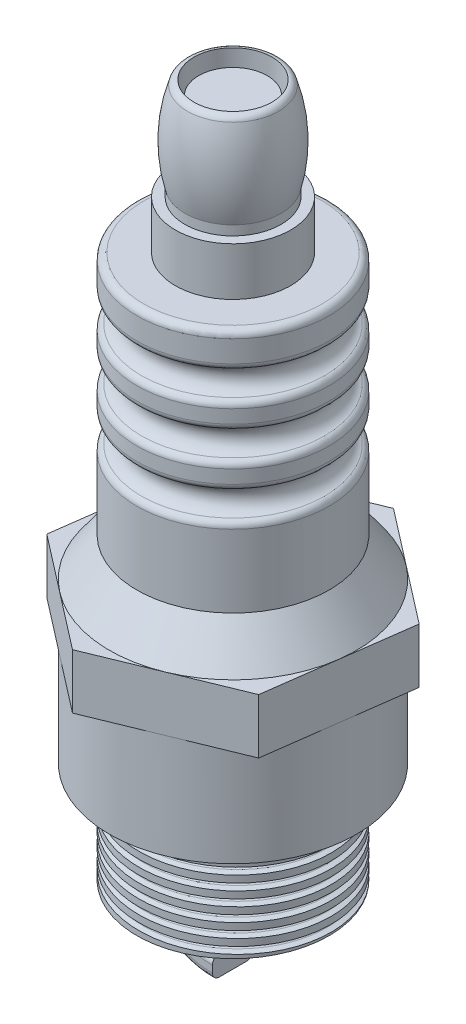
from build123d import *

# Parameters (mm, degrees)
BOSS_EXTRUDE1_DEPTH = 4
CUT_SWEEP1_PITCH    = 1
CUT_SWEEP1_FROM     = 0
SKETCH7_R           = 3.75
SKETCH7_R_2         = 2.5
CUT_EXTRUDE1_DEPTH  = 7.4
SKETCH8_R           = 1.25
BOSS_EXTRUDE2_DEPTH = 1
SKETCH11_R          = 2.842717716
CUT_EXTRUDE2_DEPTH  = 2
SKETCH12_R          = 2.5
BOSS_EXTRUDE3_DEPTH = 1


with BuildPart() as part:
    # Sketch1 → Revolve1 (revolve)
    with BuildSketch(Plane.XY, mode=Mode.PRIVATE) as revolve1_sk:
        Polygon((0, 0), (7, 0), (7, 7.4), (9, 7.4), (9, 19), (7, 21.8), (0, 21.8), align=None)
        with BuildLine():
            Line((0, 39.6), (0, 21.8))
            Line((0, 21.8), (7, 21.8))
            Line((7, 21.8), (7, 27.085786438))
            ThreePointArc((7, 27.085786438), (6.90824829, 27.374461572), (6.666666667, 27.557190958))
            ThreePointArc((6.666666667, 27.557190958), (6, 28.5), (6.666666667, 29.442809042))
            ThreePointArc((6.666666667, 29.442809042), (6.90824829, 29.625538428), (7, 29.914213562))
            Line((7, 29.914213562), (7, 30.885786438))
            ThreePointArc((7, 30.885786438), (6.90824829, 31.174461572), (6.666666667, 31.357190958))
            ThreePointArc((6.666666667, 31.357190958), (6, 32.3), (6.666666667, 33.242809042))
            ThreePointArc((6.666666667, 33.242809042), (6.90824829, 33.425538428), (7, 33.714213562))
            Line((7, 33.714213562), (7, 34.685786438))
            ThreePointArc((7, 34.685786438), (6.90824829, 34.974461572), (6.666666667, 35.157190958))
            ThreePointArc((6.666666667, 35.157190958), (6, 36.1), (6.666666667, 37.042809042))
            ThreePointArc((6.666666667, 37.042809042), (6.90824829, 37.225538428), (7, 37.514213562))
            Line((7, 37.514213562), (7, 39.1))
            ThreePointArc((7, 39.1), (6.853553391, 39.453553391), (6.5, 39.6))
            Line((6.5, 39.6), (4.2, 39.6))
            Line((4.2, 39.6), (0, 39.6))
        make_face()
        with BuildLine():
            Line((0, 50.5), (0, 39.6))
            Line((0, 39.6), (4.2, 39.6))
            Line((4.2, 39.6), (4.2, 43.11249535))
            Line((4.2, 43.11249535), (3.5, 43.11249535))
            Line((3.5, 43.11249535), (3.5, 43.806615202))
            ThreePointArc((3.5, 43.806615202), (3.864448874, 46.993450399), (3.318337588, 50.154226256))
            ThreePointArc((3.318337588, 50.154226256), (3.136730363, 50.40442127), (2.842717716, 50.5))
            Line((2.842717716, 50.5), (0, 50.5))
        make_face()
    revolve(revolve1_sk.sketch.rotate(Axis((0, 0, 0), (0, 1, 0)), 90), axis=Axis((0, 0, 0), (0, 1, 0)))

    # Sketch2 → Boss-Extrude1 (add)
    with BuildSketch(Plane(origin=(0, 19, 0), x_dir=(1, 0, 0), z_dir=(0, 1, 0))):
        Polygon((-8.224076362, 6.353311577), (-9.614167405, -3.945603264), (-1.390091042, -10.298914841), (8.224076362, -6.353311577), (9.614167405, 3.945603264), (1.390091042, 10.298914841), align=None)
    extrude(amount=-BOSS_EXTRUDE1_DEPTH)

    # Cut-Sweep1: arcs per turn and ends read off the stored shape
    # Cut-Sweep1: the profile of Sketch6 screwed along a left-hand helix through 9.25 turns, 8 arcs to a turn; built about Z, then put on its axis
    cut_sweep1_z = Axis((0, 0, 0), (0, 0, 1))
    cut_sweep1_corners = [(6.655113971, 0, -1.141834799), (7.005113971, 0, -1.248330775), (7.005113971, 0, -0.748330775), (6.655113971, 0, -0.854826751), (6.548778546, 0, -0.998330775)]
    with BuildLine(mode=Mode.PRIVATE) as cut_sweep1_profile:
        Line(cut_sweep1_corners[0], cut_sweep1_corners[1])
        Line(cut_sweep1_corners[1], cut_sweep1_corners[2])
        Line(cut_sweep1_corners[2], cut_sweep1_corners[3])
        ThreePointArc((6.655113971, 0, -0.854826751), (6.578259489, 0, -0.909027041), (6.548778546, 0, -0.998330775))
        ThreePointArc((6.548778546, 0, -0.998330775), (6.578259489, 0, -1.087634509), (6.655113971, 0, -1.141834799))
    cut_sweep1_cap = Face(cut_sweep1_profile.wire())
    cut_sweep1_arcs = [((6.655113971, 0, -0.854826751), (6.548778546, 0, -0.887181879), (6.548778546, 0, -0.998330775), (1, 0.8034603797536841, 1)), ((6.548778546, 0, -0.998330775), (6.548778546, 0, -1.109479671), (6.655113971, 0, -1.141834799), (1, 0.8034603797536841, 1))]  # start, shoulder, end, weights
    cut_sweep1_turn_angles = [0, -22.5, -45, -67.5, -90, -112.5, -135, -157.5, -180, -202.5, -225, -247.5, -270, -292.5, -315, -337.5, -360]
    cut_sweep1_turn_weights = [1, 0.9238795325112867, 1, 0.9238795325112867, 1, 0.9238795325112867, 1, 0.9238795325112867, 1, 0.9238795325112867, 1, 0.9238795325112867, 1, 0.9238795325112867, 1, 0.9238795325112867, 1]
    cut_sweep1_turn_rails = [Edge.make_bspline([Vector(p[0], p[1], 0).rotate(cut_sweep1_z, cut_sweep1_turn_angles[k]) / cut_sweep1_turn_weights[k] + Vector(0, 0, p[2] + -CUT_SWEEP1_PITCH * cut_sweep1_turn_angles[k] / 360) for k in range(17)], [0, 0, 0, 1, 1, 2, 2, 3, 3, 4, 4, 5, 5, 6, 6, 7, 7, 8, 8, 8], 2, cut_sweep1_turn_weights) for p in cut_sweep1_corners]
    cut_sweep1_turn_sides = [*[Face.make_surface_from_curves(cut_sweep1_turn_rails[p[0]], cut_sweep1_turn_rails[p[1]]) for p in [(0, 1), (1, 2), (2, 3)]], *[Face.make_bezier_surface([[Vector(p[j][0], p[j][1], 0).rotate(cut_sweep1_z, cut_sweep1_turn_angles[2 * i + k]) / cut_sweep1_turn_weights[2 * i + k] + Vector(0, 0, p[j][2] + -CUT_SWEEP1_PITCH * cut_sweep1_turn_angles[2 * i + k] / 360) for k in range(3)] for j in range(3)], [[p[3][j] * cut_sweep1_turn_weights[2 * i + k] for k in range(3)] for j in range(3)]) for p in cut_sweep1_arcs for i in range(8)]]
    cut_sweep1_last_angles = [-3240, -3262.5, -3285, -3307.5, -3330]
    cut_sweep1_last_weights = [1, 0.9238795325112867, 1, 0.9238795325112867, 1]
    cut_sweep1_last_rails = [Edge.make_bspline([Vector(p[0], p[1], 0).rotate(cut_sweep1_z, cut_sweep1_last_angles[k]) / cut_sweep1_last_weights[k] + Vector(0, 0, p[2] + -CUT_SWEEP1_PITCH * cut_sweep1_last_angles[k] / 360) for k in range(5)], [0, 0, 0, 1, 1, 2, 2, 2], 2, cut_sweep1_last_weights) for p in cut_sweep1_corners]
    cut_sweep1_last_sides = [*[Face.make_surface_from_curves(cut_sweep1_last_rails[p[0]], cut_sweep1_last_rails[p[1]]) for p in [(0, 1), (1, 2), (2, 3)]], *[Face.make_bezier_surface([[Vector(p[j][0], p[j][1], 0).rotate(cut_sweep1_z, cut_sweep1_last_angles[2 * i + k]) / cut_sweep1_last_weights[2 * i + k] + Vector(0, 0, p[j][2] + -CUT_SWEEP1_PITCH * cut_sweep1_last_angles[2 * i + k] / 360) for k in range(3)] for j in range(3)], [[p[3][j] * cut_sweep1_last_weights[2 * i + k] for k in range(3)] for j in range(3)]) for p in cut_sweep1_arcs for i in range(2)]]
    cut_sweep1 = Plane(origin=(0, 7.4, 0), x_dir=(1, 0, 0), z_dir=(0, -1, 0)) * split(Solid(Shell([*[p.moved(Location((0, 0, CUT_SWEEP1_PITCH * i))) for i in range(9) for p in cut_sweep1_turn_sides], *cut_sweep1_last_sides, cut_sweep1_cap, cut_sweep1_cap.rotate(cut_sweep1_z, -3330).moved(Location((0, 0, -CUT_SWEEP1_PITCH * -3330 / 360)))])), bisect_by=Plane.XY.offset(CUT_SWEEP1_FROM), keep=Keep.TOP, mode=Mode.PRIVATE)
    add(cut_sweep1, mode=Mode.SUBTRACT)

    # Sketch7 → Cut-Extrude1 (cut)
    with BuildSketch(Plane.XZ):
        with Locations(Location((0, 0, 0), (0, 0, 270))):
            Circle(SKETCH7_R)
        with Locations(Location((0, 0, 0), (0, 0, 270))):
            Circle(SKETCH7_R_2, mode=Mode.SUBTRACT)
    extrude(amount=-CUT_EXTRUDE1_DEPTH, mode=Mode.SUBTRACT)

    # Sketch8 → Boss-Extrude2 (add)
    with BuildSketch(Plane.XZ):
        with Locations(Location((0, 0, 0), (0, 0, 270))):
            Circle(SKETCH8_R)
    extrude(amount=BOSS_EXTRUDE2_DEPTH)

    # Sweep1: sweep along a path in Sketch10
    with BuildLine(Plane.XY) as sweep1_path:
        ThreePointArc((-5, 0), (-3.505500474, -3.463026787), (0, -4.854985763))
    # Sketch9 → Sweep1 (sweep)
    with BuildSketch(Plane.XZ):
        with BuildLine():
            Line((-5.25, 1.5), (-4.75, 1.5))
            ThreePointArc((-4.75, 1.5), (-4.396446609, 1.353553391), (-4.25, 1))
            Line((-4.25, 1), (-4.25, -1))
            ThreePointArc((-4.25, -1), (-4.396446609, -1.353553391), (-4.75, -1.5))
            Line((-4.75, -1.5), (-5.25, -1.5))
            ThreePointArc((-5.25, -1.5), (-5.603553391, -1.353553391), (-5.75, -1))
            Line((-5.75, -1), (-5.75, 1))
            ThreePointArc((-5.75, 1), (-5.603553391, 1.353553391), (-5.25, 1.5))
        make_face()
    sweep(path=sweep1_path.line)

    # Sketch11 → Cut-Extrude2 (cut)
    with BuildSketch(Plane(origin=(0, 50.5, 0), x_dir=(1, 0, 0), z_dir=(0, 1, 0))):
        with Locations(Location((0, 0, 0), (0, 0, 270))):
            Circle(SKETCH11_R)
    extrude(amount=-CUT_EXTRUDE2_DEPTH, mode=Mode.SUBTRACT)

    # Sketch12 → Boss-Extrude3 (add)
    with BuildSketch(Plane(origin=(0, 48.5, 0), x_dir=(1, 0, 0), z_dir=(0, 1, 0))):
        with Locations(Location((0, 0, 0), (0, 0, 90))):
            Circle(SKETCH12_R)
    extrude(amount=BOSS_EXTRUDE3_DEPTH)


solid = part.part
